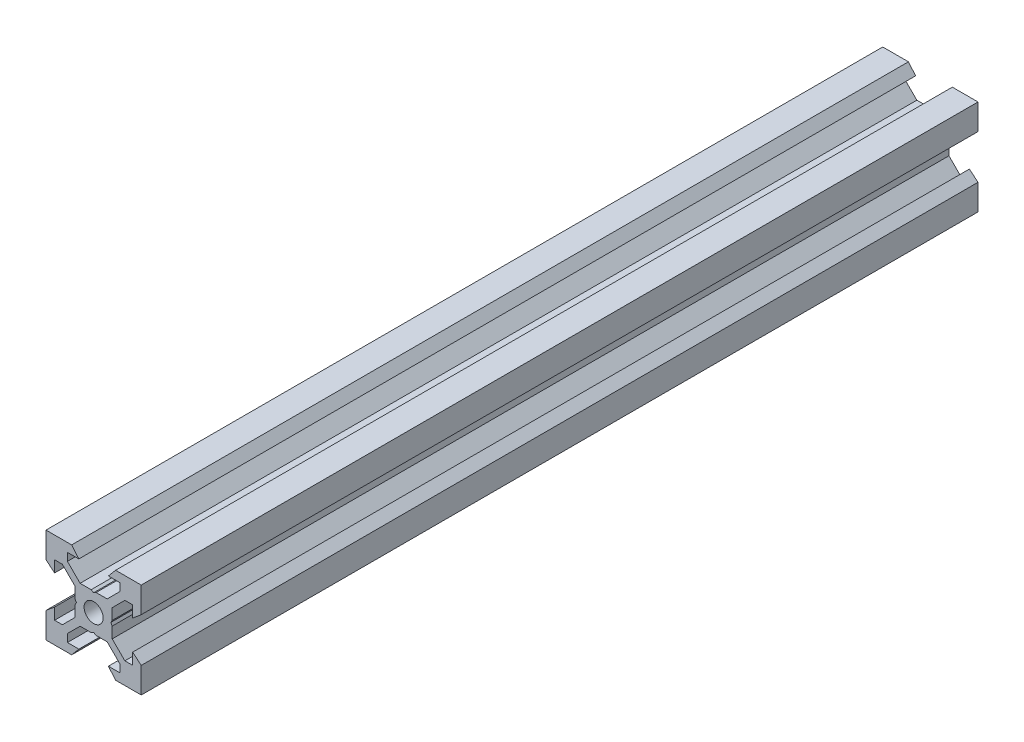
from build123d import *

# Parameters (mm, degrees)
SKETCH1_R           = 2
BOSS_EXTRUDE1_DEPTH = 87.855


with BuildPart() as part:
    # Sketch1 → Boss-Extrude1 (new, symmetric)
    with BuildSketch(Plane.XY):
        Polygon((10, 4.610379336), (10, 10), (4.610379336, 10), (3.1, 8.2), (5.5, 8.2), (5.5, 6.560660172), (2.839339828, 3.9), (0.519615242, 3.9), (0, 3.6), (-0.519615242, 3.9), (-2.839339828, 3.9), (-5.5, 6.560660172), (-5.5, 8.2), (-3.1, 8.2), (-4.610379336, 10), (-10, 10), (-10, 4.610379336), (-8.2, 3.1), (-8.2, 5.5), (-6.560660172, 5.5), (-3.9, 2.839339828), (-3.9, 0.519615242), (-3.6, 0), (-3.9, -0.519615242), (-3.9, -2.839339828), (-6.560660172, -5.5), (-8.2, -5.5), (-8.2, -3.1), (-10, -4.610379336), (-10, -10), (-4.610379336, -10), (-3.1, -8.2), (-5.5, -8.2), (-5.5, -6.560660172), (-2.839339828, -3.9), (-0.519615242, -3.9), (0, -3.6), (0.519615242, -3.9), (2.839339828, -3.9), (5.5, -6.560660172), (5.5, -8.2), (3.1, -8.2), (4.610379336, -10), (10, -10), (10, -4.610379336), (8.2, -3.1), (8.2, -5.5), (6.560660172, -5.5), (3.9, -2.839339828), (3.9, -0.519615242), (3.6, 0), (3.9, 0.519615242), (3.9, 2.839339828), (6.560660172, 5.5), (8.2, 5.5), (8.2, 3.1), align=None)
        Circle(SKETCH1_R, mode=Mode.SUBTRACT)
    extrude(amount=BOSS_EXTRUDE1_DEPTH, both=True)


solid = part.part
